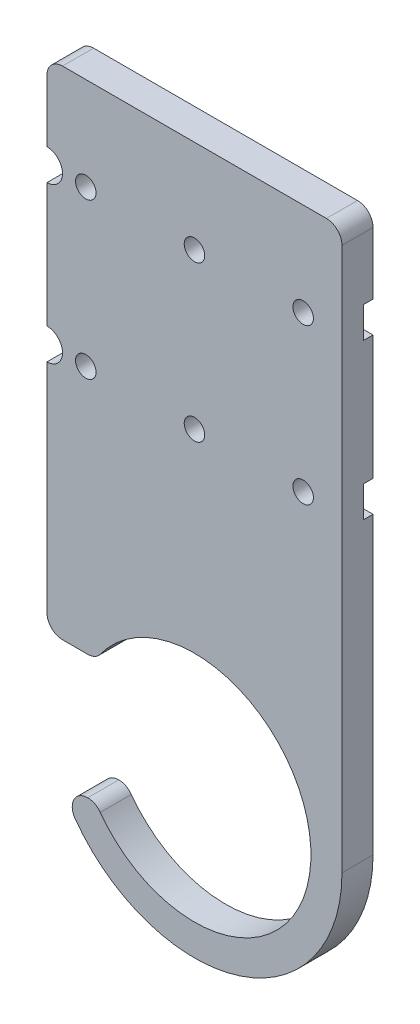
from build123d import *

# Parameters (mm, degrees)
SKETCH_1_R          = 3.3
EXTRUDE_1_DEPTH     = 10
SKETCH_1_4_R        = 3.3
CUT_EXTRUDE_1_DEPTH = 3
FILLET_4_R          = 5
FILLET_8_R          = 5


with BuildPart() as part:
    # 스케치1 → 보스-돌출1 (new body)
    with BuildSketch(Plane.XY):
        with BuildLine():
            Line((-47.5, 95), (-47.5, 20))
            Line((-47.5, 20), (-31.721443851, 20))
            ThreePointArc((-31.721443851, 20), (37.5, 0), (-31.721443851, -20))
            Line((-31.721443851, -20), (-43.084219849, -20))
            ThreePointArc((-43.084219849, -20), (10.240838764, -46.382919501), (47.5, 0))
            Line((47.5, 0), (47.5, 180))
            Line((47.5, 180), (-47.5, 180))
            Line((-47.5, 180), (-47.5, 155))
            ThreePointArc((-47.5, 155), (-42.5, 150), (-47.5, 145))
            Line((-47.5, 145), (-47.5, 105))
            ThreePointArc((-47.5, 105), (-42.5, 100), (-47.5, 95))
        make_face()
        with Locations((35, 100)):
            Circle(SKETCH_1_R, mode=Mode.SUBTRACT)
        with Locations((-35, 100)):
            Circle(SKETCH_1_R, mode=Mode.SUBTRACT)
        with Locations((0, 100)):
            Circle(SKETCH_1_R, mode=Mode.SUBTRACT)
        with Locations((35, 150)):
            Circle(SKETCH_1_R, mode=Mode.SUBTRACT)
        with Locations((-35, 150)):
            Circle(SKETCH_1_R, mode=Mode.SUBTRACT)
        with Locations((0, 150)):
            Circle(SKETCH_1_R, mode=Mode.SUBTRACT)
    extrude(amount=EXTRUDE_1_DEPTH)

    # 스케치1<4> → 컷-돌출1 (cut)
    # profile 1 of 2: a face of its own
    with BuildSketch(Plane.XY):
        with BuildLine():
            ThreePointArc((-47.5, 105), (-42.5, 100), (-47.5, 95))
            Line((-47.5, 95), (47.5, 95))
            Line((47.5, 95), (47.5, 105))
            Line((47.5, 105), (-47.5, 105))
        make_face()
        with Locations((-35, 100)):
            Circle(SKETCH_1_4_R, mode=Mode.SUBTRACT)
        with Locations((0, 100)):
            Circle(SKETCH_1_4_R, mode=Mode.SUBTRACT)
        with Locations((35, 100)):
            Circle(SKETCH_1_4_R, mode=Mode.SUBTRACT)
    # profile 2 of 2: a face of its own
    with BuildSketch(Plane.XY):
        with BuildLine():
            ThreePointArc((-47.5, 155), (-42.5, 150), (-47.5, 145))
            Line((-47.5, 145), (47.5, 145))
            Line((47.5, 145), (47.5, 155))
            Line((47.5, 155), (-47.5, 155))
        make_face()
        with Locations((-35, 150)):
            Circle(SKETCH_1_4_R, mode=Mode.SUBTRACT)
        with Locations((0, 150)):
            Circle(SKETCH_1_4_R, mode=Mode.SUBTRACT)
        with Locations((35, 150)):
            Circle(SKETCH_1_4_R, mode=Mode.SUBTRACT)
    extrude(amount=CUT_EXTRUDE_1_DEPTH, mode=Mode.SUBTRACT)

    # 필렛4
    fillet_4_edges = [part.edges().sort_by_distance(p)[0] for p in [
        (-31.721443851, 20, 5),
        (-47.5, 20, 5),
        (-31.721443851, -20, 5),
        (-43.084219849, -20, 5),
    ]]
    fillet(fillet_4_edges, radius=FILLET_4_R - 0.0001)  # a hair under: the kernel refuses the full size

    # 필렛8
    fillet_8_edges = [part.edges().sort_by_distance(p)[0] for p in [
        (-47.5, 180, 5),
        (47.5, 180, 5),
    ]]
    fillet(fillet_8_edges, radius=FILLET_8_R)


solid = part.part
